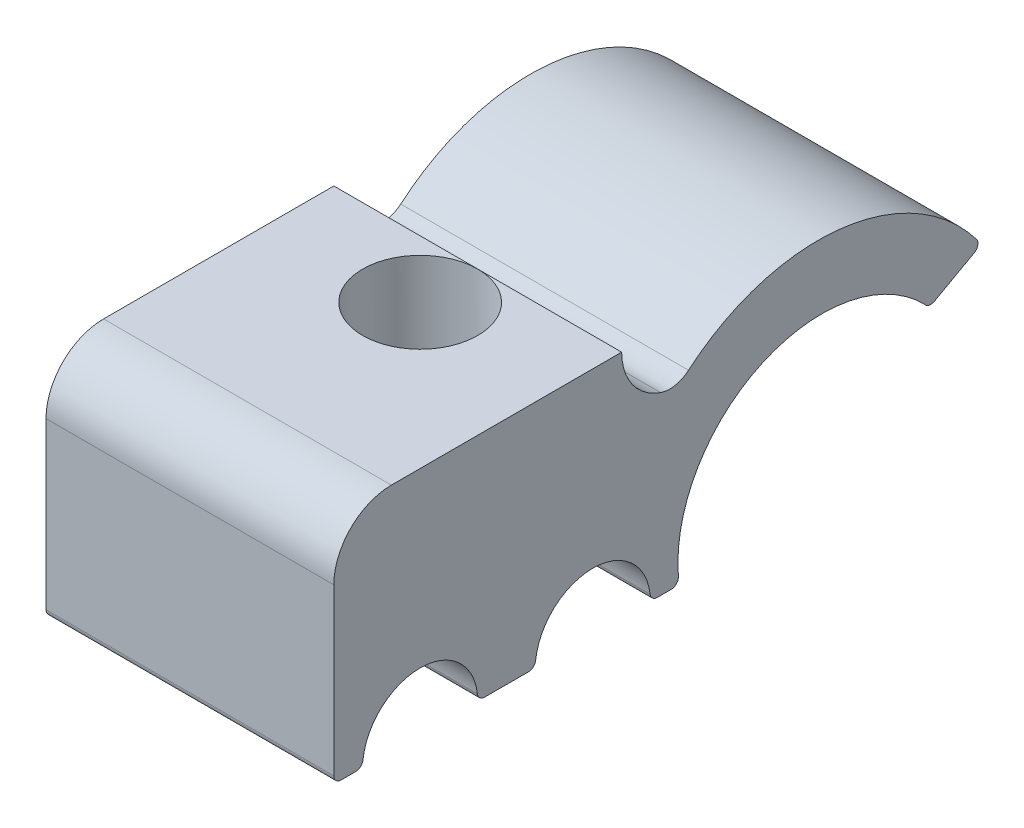
from build123d import *

# Parameters (mm, degrees)
BOSS_EXTRUDE1_DEPTH = 10
FILLET1_START       = -1
FILLET1_DEPTH       = 12
FILLET1_2_DEPTH     = 10
FILLET2_R           = 1
FILLET3_R           = 0.25
SKETCH2_R           = 2
CUT_EXTRUDE1_DEPTH  = 26.785330572


with BuildPart() as part:
    # Sketch1 → Boss-Extrude1 (new body)
    with BuildSketch(Plane(origin=(0, 0, 0), x_dir=(0, 0, -1), z_dir=(1, 0, 0))):
        with BuildLine():
            Line((0, 0), (0, 8))
            Line((0, 8), (10, 8))
            Line((10, 8), (10, 6))
            Line((10, 6), (12, 6))
            ThreePointArc((12, 6), (17.480620462, 7.92151485), (22.5, 5))
            Line((22.5, 5), (20.689313396, 4))
            ThreePointArc((20.689313396, 4), (14.863284967, 5.218025808), (12, 0))
            Line((12, 0), (11, 0))
            ThreePointArc((11, 0), (9, 2), (7, 0))
            Line((7, 0), (5, 0))
            ThreePointArc((5, 0), (3, 2), (1, 0))
            Line((1, 0), (0, 0))
        make_face()
    extrude(amount=BOSS_EXTRUDE1_DEPTH)

    # Fillet1: read off the stored shape, not the designer's step
    # Fillet1 outline → Fillet1 (cut)
    with BuildSketch(Plane.YZ.offset(FILLET1_START)):
        with BuildLine():
            ThreePointArc((6, 0), (7.414213562, -0.585786438), (8, -2))
            Line((8, -2), (8, 0))
            Line((8, 0), (6, 0))
        make_face()
    extrude(amount=FILLET1_DEPTH, mode=Mode.SUBTRACT)

    # Fillet1 2 outline → Fillet1 2 (add)
    with BuildSketch(Plane.YZ):
        with BuildLine():
            ThreePointArc((6, -12), (6.585786438, -10.585786438), (8, -10))
            Line((8, -10), (6, -10))
            Line((6, -10), (6, -12))
        make_face()
    extrude(amount=FILLET1_2_DEPTH)

    # Fillet2
    fillet2_edges = [part.edges().sort_by_distance(p)[0] for p in [
        (5, 6, -12),
    ]]
    fillet(fillet2_edges, radius=FILLET2_R)

    # Fillet3
    fillet3_edges = [part.edges().sort_by_distance(p)[0] for p in [
        (5, 0, 0),
        (5, 5, -22.5),
        (5, 4, -20.689313396),
        (5, 0, -12),
        (5, 0, -11),
        (5, 0, -7),
        (5, 0, -5),
        (5, 0, -1),
    ]]
    fillet(fillet3_edges, radius=FILLET3_R)

    # Sketch2 → Cut-Extrude1 (cut, through all)
    with BuildSketch(Plane(origin=(0, 8, 0), x_dir=(1, 0, 0), z_dir=(0, 1, 0))):
        with Locations(Location((5, 8, 0), (0, 0, 321.827292373))):
            Circle(SKETCH2_R)
    extrude(amount=-CUT_EXTRUDE1_DEPTH, mode=Mode.SUBTRACT)


solid = part.part
